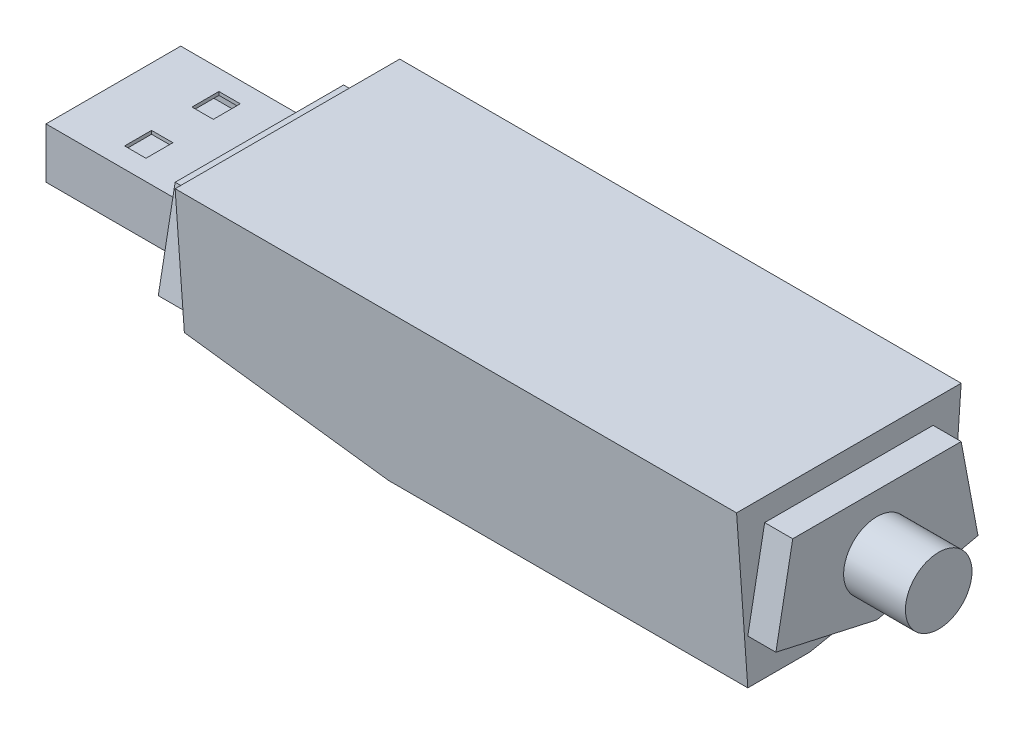
from build123d import *

# Parameters (mm, degrees)
SKETCH1_W           = 50
SKETCH1_H           = 20
BOSS_EXTRUDE1_DEPTH = 14
BOSS_EXTRUDE2_DEPTH = 2.5
SKETCH3_W           = 12
SKETCH3_H           = 4.5
SKETCH3_W_2         = 11.4
SKETCH3_H_2         = 3.9
EXTRUDE_THIN1_DEPTH = 13
SKETCH3_3_W         = 11.4
SKETCH3_3_H         = 1.95
BOSS_EXTRUDE3_DEPTH = 13
SKETCH5_W           = 1.9
SKETCH5_H           = 2.4
CUT_EXTRUDE1_DEPTH  = 0.3
SKETCH6_R           = 2.965
BOSS_EXTRUDE4_DEPTH = 5.5
CHAMFER1_SIZE       = 14
CHAMFER1_SIZE_2     = 1
CHAMFER2_SIZE       = 14
CHAMFER2_SIZE_2     = 1
CHAMFER3_START      = -5
CHAMFER3_OUTLINE_W  = 21
CHAMFER3_OUTLINE_H  = 16
CHAMFER3_DEPTH      = 3.756672606
CHAMFER6_START      = 4.059410809
CHAMFER6_OUTLINE_W  = 21
CHAMFER6_OUTLINE_H  = 16
CHAMFER6_DEPTH      = 2.940589191


with BuildPart() as part:
    # Sketch1 → Boss-Extrude1 (new body)
    with BuildSketch(Plane(origin=(0, 0, 0), x_dir=(1, 0, 0), z_dir=(0, 1, 0))):
        with Locations((25, -10)):
            Rectangle(SKETCH1_W, SKETCH1_H)
    extrude(amount=BOSS_EXTRUDE1_DEPTH)

    # Sketch2 → Boss-Extrude2 (add)
    with BuildSketch(Plane.ZY):
        Polygon((2.5, 12), (17.5, 12), (19, 4), (10, 2), (1, 4), align=None)
    boss_extrude2 = extrude(amount=BOSS_EXTRUDE2_DEPTH)

    # Mirror1: Boss-Extrude2 across plane
    add(boss_extrude2.mirror(Plane.ZY.offset(-25)))

    # Sketch3 → Extrude-Thin1 (add)
    with BuildSketch(Plane.ZY.offset(2.5)):
        with Locations((10, 7)):
            Rectangle(SKETCH3_W, SKETCH3_H)
        with Locations((10, 7)):
            Rectangle(SKETCH3_W_2, SKETCH3_H_2, mode=Mode.SUBTRACT)
    extrude(amount=EXTRUDE_THIN1_DEPTH)

    # Sketch5 → Cut-Extrude1 (cut)
    with BuildSketch(Plane(origin=(0, 9.25, 0), x_dir=(1, 0, 0), z_dir=(0, 1, 0))):
        with Locations((-9.35, -13)):
            Rectangle(SKETCH5_W, SKETCH5_H)
        with Locations((-9.35, -7)):
            Rectangle(SKETCH5_W, SKETCH5_H)
    extrude(amount=-CUT_EXTRUDE1_DEPTH, mode=Mode.SUBTRACT)

    # Sketch6 → Boss-Extrude4 (add)
    with BuildSketch(Plane(origin=(52.5, 0, 0), x_dir=(0, 0, -1), z_dir=(1, 0, 0))):
        with Locations((-10, 7)):
            Circle(SKETCH6_R)
    extrude(amount=BOSS_EXTRUDE4_DEPTH)

    # Chamfer1
    # the kernel refuses this chamfer: 14, 1 mm, written as the material it takes off along each edge
    with BuildSketch(Plane(origin=(-36.396578858, 0, 0), x_dir=(0, 1, 0), z_dir=(1, 0, 0))) as chamfer1_piece_1:
        Polygon((CHAMFER1_SIZE, 0), (0, CHAMFER1_SIZE_2), (0, 0), align=None)
    extrude(amount=122.793157716, mode=Mode.SUBTRACT)

    # Chamfer2
    # the kernel refuses this chamfer: 14, 1 mm, written as the material it takes off along each edge
    with BuildSketch(Plane(origin=(86.396578858, 0, 20), x_dir=(0, 1, 0), z_dir=(-1, 0, 0))) as chamfer2_piece_1:
        Polygon((CHAMFER2_SIZE, 0), (0, CHAMFER2_SIZE_2), (0, 0), align=None)
    extrude(amount=122.793157716, mode=Mode.SUBTRACT)

    # Chamfer3: read off the stored shape, not the designer's step
    # Chamfer3 outline → Chamfer3 (cut)
    with BuildSketch(Plane(origin=(0, 0, 0), x_dir=(0.9911382828246236, -0.13033690205825316, 0.025635839781716227), z_dir=(0.13283412332475603, 0.9725053326762371, -0.19128113758764903)).offset(CHAMFER3_START)):
        with Locations((9.5, -13)):
            Rectangle(CHAMFER3_OUTLINE_W, CHAMFER3_OUTLINE_H)
    extrude(amount=CHAMFER3_DEPTH, mode=Mode.SUBTRACT)

    # Chamfer6: read off the stored shape, not the designer's step
    # Chamfer6 outline → Chamfer6 (cut)
    with BuildSketch(Plane(origin=(0, 0, 0), x_dir=(0.9911382828246236, 0.13033690205825316, 0.025635839781716227), z_dir=(0.13283412332475603, -0.9725053326762371, -0.19128113758764903)).offset(CHAMFER6_START)):
        with Locations((40.5, 7)):
            Rectangle(CHAMFER6_OUTLINE_W, CHAMFER6_OUTLINE_H)
    extrude(amount=CHAMFER6_DEPTH, mode=Mode.SUBTRACT)


with BuildPart() as body_2:
    # Sketch3<3> → Boss-Extrude3 (new body)
    with BuildSketch(Plane.ZY.offset(2.5)):
        with Locations((10, 6.025)):
            Rectangle(SKETCH3_3_W, SKETCH3_3_H)
    extrude(amount=BOSS_EXTRUDE3_DEPTH)


solid = Compound([part.part, body_2.part])
